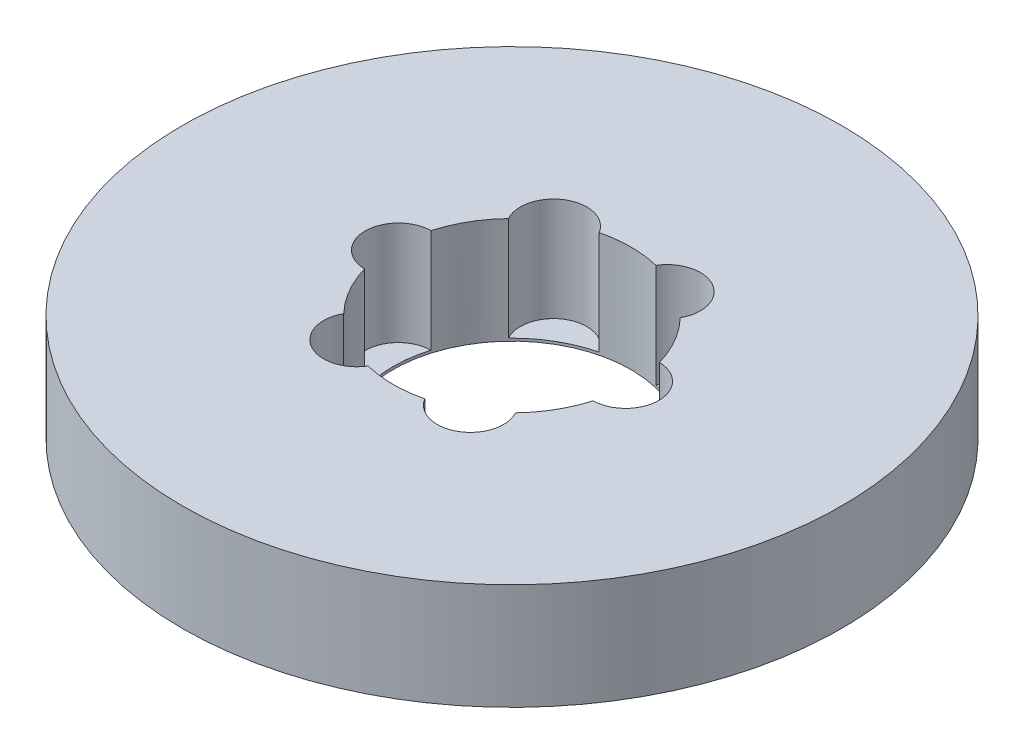
from build123d import *

# Parameters (mm, degrees)
SKETCH1_R           = 90
BOSS_EXTRUDE1_DEPTH = 29
SKETCH2_R           = 32.5
CUT_EXTRUDE1_DEPTH  = 131.541181242
SKETCH3_R           = 9.072685536
CUT_EXTRUDE2_DEPTH  = 28.283983698
CIRPATTERN1_COUNT   = 6


with BuildPart() as part:
    # Sketch1 → Boss-Extrude1 (new body)
    with BuildSketch(Plane(origin=(0, 0, 0), x_dir=(1, 0, 0), z_dir=(0, 1, 0))):
        Circle(SKETCH1_R)
    extrude(amount=BOSS_EXTRUDE1_DEPTH)

    # Sketch2 → Cut-Extrude1 (cut, through all)
    with BuildSketch(Plane(origin=(0, 0, 0), x_dir=(1, 0, 0), z_dir=(0, 1, 0))):
        Circle(SKETCH2_R)
    extrude(amount=CUT_EXTRUDE1_DEPTH, mode=Mode.SUBTRACT)

    # Sketch3 → Cut-Extrude2 (cut)
    with BuildSketch(Plane(origin=(0, 29, 0), x_dir=(1, 0, 0), z_dir=(0, 1, 0))):
        with Locations((-31.022634269, 0)):
            Circle(SKETCH3_R)
    cut_extrude2 = extrude(amount=-CUT_EXTRUDE2_DEPTH, mode=Mode.SUBTRACT)

    # CirPattern1: Cut-Extrude2 ×6 about axis
    cirpattern1_axis = Axis((0, 0, 0), (0, 1, 0))
    for i in range(1, CIRPATTERN1_COUNT):
        add(cut_extrude2.rotate(cirpattern1_axis, i * 360 / CIRPATTERN1_COUNT), mode=Mode.SUBTRACT)


solid = part.part
